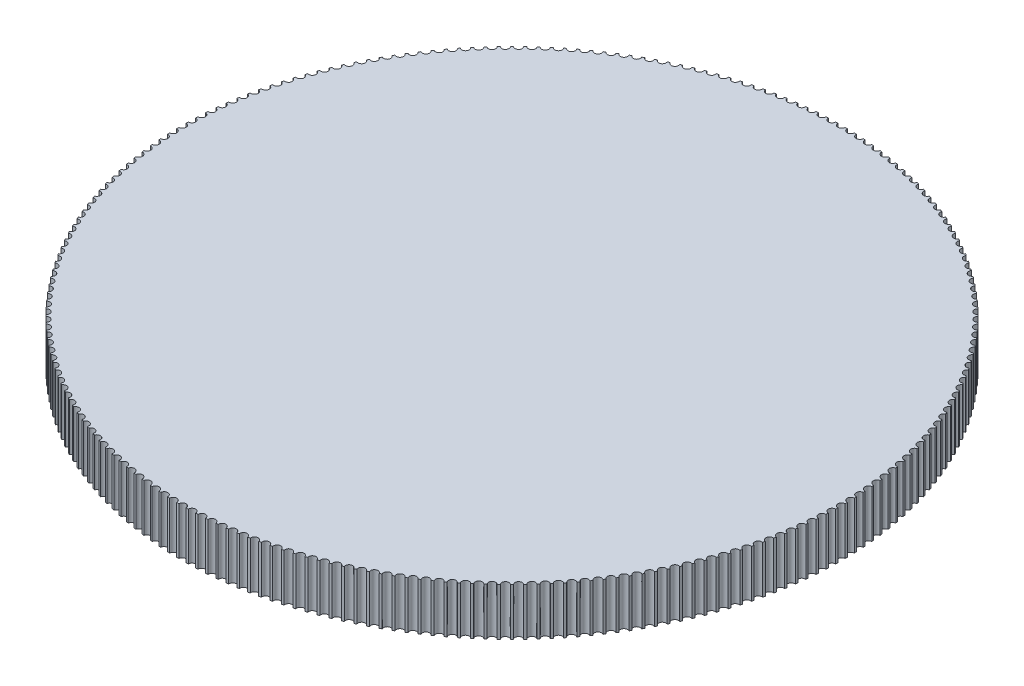
from build123d import *

# Parameters (mm, degrees)
SKETCH1_R           = 69.255
BOSS_EXTRUDE1_DEPTH = 10
SKETCH2_R           = 0.755
CUT_EXTRUDE2_DEPTH  = 10


with BuildPart() as part:
    # Sketch1 → Boss-Extrude1 (new body)
    with BuildSketch(Plane(origin=(0, 0, 0), x_dir=(1, 0, 0), z_dir=(0, 1, 0))):
        with Locations(Location((0, 0, 0), (0, 0, 270))):
            Circle(SKETCH1_R)
    extrude(amount=BOSS_EXTRUDE1_DEPTH)

    # Sketch2 → Cut-Extrude2 (cut)
    with BuildSketch(Plane(origin=(0, 10, 0), x_dir=(1, 0, 0), z_dir=(0, 1, 0))):
        with Locations((69.255, 0)):
            Circle(SKETCH2_R)
        with Locations((69.226757314, -1.977649298)):
            Circle(SKETCH2_R)
        with Locations((69.142052292, -3.953685596)):
            Circle(SKETCH2_R)
        with Locations((69.000954021, -5.926497212)):
            Circle(SKETCH2_R)
        with Locations((68.803577582, -7.894475092)):
            Circle(SKETCH2_R)
        with Locations((68.550083957, -9.856014125)):
            Circle(SKETCH2_R)
        with Locations((68.240679902, -11.809514451)):
            Circle(SKETCH2_R)
        with Locations((67.875617768, -13.753382768)):
            Circle(SKETCH2_R)
        with Locations((67.455195308, -15.686033628)):
            Circle(SKETCH2_R)
        with Locations((66.979755422, -17.605890735)):
            Circle(SKETCH2_R)
        with Locations((66.449685888, -19.511388224)):
            Circle(SKETCH2_R)
        with Locations((65.865419036, -21.400971945)):
            Circle(SKETCH2_R)
        with Locations((65.227431404, -23.273100727)):
            Circle(SKETCH2_R)
        with Locations((64.536243343, -25.126247634)):
            Circle(SKETCH2_R)
        with Locations((63.792418596, -26.958901213)):
            Circle(SKETCH2_R)
        with Locations((62.996563838, -28.769566725)):
            Circle(SKETCH2_R)
        with Locations((62.149328179, -30.556767367)):
            Circle(SKETCH2_R)
        with Locations((61.251402636, -32.31904547)):
            Circle(SKETCH2_R)
        with Locations((60.303519571, -34.054963696)):
            Circle(SKETCH2_R)
        with Locations((59.30645209, -35.763106206)):
            Circle(SKETCH2_R)
        with Locations((58.261013416, -37.442079813)):
            Circle(SKETCH2_R)
        with Locations((57.168056224, -39.090515123)):
            Circle(SKETCH2_R)
        with Locations((56.028471945, -40.707067648)):
            Circle(SKETCH2_R)
        with Locations((54.843190041, -42.290418904)):
            Circle(SKETCH2_R)
        with Locations((53.613177245, -43.839277489)):
            Circle(SKETCH2_R)
        with Locations((52.339436772, -45.352380129)):
            Circle(SKETCH2_R)
        with Locations((51.023007504, -46.828492718)):
            Circle(SKETCH2_R)
        with Locations((49.664963139, -48.266411317)):
            Circle(SKETCH2_R)
        with Locations((48.266411317, -49.664963139)):
            Circle(SKETCH2_R)
        with Locations((46.828492718, -51.023007504)):
            Circle(SKETCH2_R)
        with Locations((45.352380129, -52.339436772)):
            Circle(SKETCH2_R)
        with Locations((43.839277489, -53.613177245)):
            Circle(SKETCH2_R)
        with Locations((42.290418904, -54.843190041)):
            Circle(SKETCH2_R)
        with Locations((40.707067648, -56.028471945)):
            Circle(SKETCH2_R)
        with Locations((39.090515123, -57.168056224)):
            Circle(SKETCH2_R)
        with Locations((37.442079813, -58.261013416)):
            Circle(SKETCH2_R)
        with Locations((35.763106206, -59.30645209)):
            Circle(SKETCH2_R)
        with Locations((34.054963696, -60.303519571)):
            Circle(SKETCH2_R)
        with Locations((32.31904547, -61.251402636)):
            Circle(SKETCH2_R)
        with Locations((30.556767367, -62.149328179)):
            Circle(SKETCH2_R)
        with Locations((28.769566725, -62.996563838)):
            Circle(SKETCH2_R)
        with Locations((26.958901213, -63.792418596)):
            Circle(SKETCH2_R)
        with Locations((25.126247634, -64.536243343)):
            Circle(SKETCH2_R)
        with Locations((23.273100727, -65.227431404)):
            Circle(SKETCH2_R)
        with Locations((21.400971945, -65.865419036)):
            Circle(SKETCH2_R)
        with Locations((19.511388224, -66.449685888)):
            Circle(SKETCH2_R)
        with Locations((17.605890735, -66.979755422)):
            Circle(SKETCH2_R)
        with Locations((15.686033628, -67.455195308)):
            Circle(SKETCH2_R)
        with Locations((13.753382768, -67.875617768)):
            Circle(SKETCH2_R)
        with Locations((11.809514451, -68.240679902)):
            Circle(SKETCH2_R)
        with Locations((9.856014125, -68.550083957)):
            Circle(SKETCH2_R)
        with Locations((7.894475092, -68.803577582)):
            Circle(SKETCH2_R)
        with Locations((5.926497212, -69.000954021)):
            Circle(SKETCH2_R)
        with Locations((3.953685596, -69.142052292)):
            Circle(SKETCH2_R)
        with Locations((1.977649298, -69.226757314)):
            Circle(SKETCH2_R)
        with Locations((0, -69.255)):
            Circle(SKETCH2_R)
        with Locations((-1.977649298, -69.226757314)):
            Circle(SKETCH2_R)
        with Locations((-3.953685596, -69.142052292)):
            Circle(SKETCH2_R)
        with Locations((-5.926497212, -69.000954021)):
            Circle(SKETCH2_R)
        with Locations((-7.894475092, -68.803577582)):
            Circle(SKETCH2_R)
        with Locations((-9.856014125, -68.550083957)):
            Circle(SKETCH2_R)
        with Locations((-11.809514451, -68.240679902)):
            Circle(SKETCH2_R)
        with Locations((-13.753382768, -67.875617768)):
            Circle(SKETCH2_R)
        with Locations((-15.686033628, -67.455195308)):
            Circle(SKETCH2_R)
        with Locations((-17.605890735, -66.979755422)):
            Circle(SKETCH2_R)
        with Locations((-19.511388224, -66.449685888)):
            Circle(SKETCH2_R)
        with Locations((-21.400971945, -65.865419036)):
            Circle(SKETCH2_R)
        with Locations((-23.273100727, -65.227431404)):
            Circle(SKETCH2_R)
        with Locations((-25.126247634, -64.536243343)):
            Circle(SKETCH2_R)
        with Locations((-26.958901213, -63.792418596)):
            Circle(SKETCH2_R)
        with Locations((-28.769566725, -62.996563838)):
            Circle(SKETCH2_R)
        with Locations((-30.556767367, -62.149328179)):
            Circle(SKETCH2_R)
        with Locations((-32.31904547, -61.251402636)):
            Circle(SKETCH2_R)
        with Locations((-34.054963696, -60.303519571)):
            Circle(SKETCH2_R)
        with Locations((-35.763106206, -59.30645209)):
            Circle(SKETCH2_R)
        with Locations((-37.442079813, -58.261013416)):
            Circle(SKETCH2_R)
        with Locations((-39.090515123, -57.168056224)):
            Circle(SKETCH2_R)
        with Locations((-40.707067648, -56.028471945)):
            Circle(SKETCH2_R)
        with Locations((-42.290418904, -54.843190041)):
            Circle(SKETCH2_R)
        with Locations((-43.839277489, -53.613177245)):
            Circle(SKETCH2_R)
        with Locations((-45.352380129, -52.339436772)):
            Circle(SKETCH2_R)
        with Locations((-46.828492718, -51.023007504)):
            Circle(SKETCH2_R)
        with Locations((-48.266411317, -49.664963139)):
            Circle(SKETCH2_R)
        with Locations((-49.664963139, -48.266411317)):
            Circle(SKETCH2_R)
        with Locations((-51.023007504, -46.828492718)):
            Circle(SKETCH2_R)
        with Locations((-52.339436772, -45.352380129)):
            Circle(SKETCH2_R)
        with Locations((-53.613177245, -43.839277489)):
            Circle(SKETCH2_R)
        with Locations((-54.843190041, -42.290418904)):
            Circle(SKETCH2_R)
        with Locations((-56.028471945, -40.707067648)):
            Circle(SKETCH2_R)
        with Locations((-57.168056224, -39.090515123)):
            Circle(SKETCH2_R)
        with Locations((-58.261013416, -37.442079813)):
            Circle(SKETCH2_R)
        with Locations((-59.30645209, -35.763106206)):
            Circle(SKETCH2_R)
        with Locations((-60.303519571, -34.054963696)):
            Circle(SKETCH2_R)
        with Locations((-61.251402636, -32.31904547)):
            Circle(SKETCH2_R)
        with Locations((-62.149328179, -30.556767367)):
            Circle(SKETCH2_R)
        with Locations((-62.996563838, -28.769566725)):
            Circle(SKETCH2_R)
        with Locations((-63.792418596, -26.958901213)):
            Circle(SKETCH2_R)
        with Locations((-64.536243343, -25.126247634)):
            Circle(SKETCH2_R)
        with Locations((-65.227431404, -23.273100727)):
            Circle(SKETCH2_R)
        with Locations((-65.865419036, -21.400971945)):
            Circle(SKETCH2_R)
        with Locations((-66.449685888, -19.511388224)):
            Circle(SKETCH2_R)
        with Locations((-66.979755422, -17.605890735)):
            Circle(SKETCH2_R)
        with Locations((-67.455195308, -15.686033628)):
            Circle(SKETCH2_R)
        with Locations((-67.875617768, -13.753382768)):
            Circle(SKETCH2_R)
        with Locations((-68.240679902, -11.809514451)):
            Circle(SKETCH2_R)
        with Locations((-68.550083957, -9.856014125)):
            Circle(SKETCH2_R)
        with Locations((-68.803577582, -7.894475092)):
            Circle(SKETCH2_R)
        with Locations((-69.000954021, -5.926497212)):
            Circle(SKETCH2_R)
        with Locations((-69.142052292, -3.953685596)):
            Circle(SKETCH2_R)
        with Locations((-69.226757314, -1.977649298)):
            Circle(SKETCH2_R)
        with Locations((-69.255, 0)):
            Circle(SKETCH2_R)
        with Locations((-69.226757314, 1.977649298)):
            Circle(SKETCH2_R)
        with Locations((-69.142052292, 3.953685596)):
            Circle(SKETCH2_R)
        with Locations((-69.000954021, 5.926497212)):
            Circle(SKETCH2_R)
        with Locations((-68.803577582, 7.894475092)):
            Circle(SKETCH2_R)
        with Locations((-68.550083957, 9.856014125)):
            Circle(SKETCH2_R)
        with Locations((-68.240679902, 11.809514451)):
            Circle(SKETCH2_R)
        with Locations((-67.875617768, 13.753382768)):
            Circle(SKETCH2_R)
        with Locations((-67.455195308, 15.686033628)):
            Circle(SKETCH2_R)
        with Locations((-66.979755422, 17.605890735)):
            Circle(SKETCH2_R)
        with Locations((-66.449685888, 19.511388224)):
            Circle(SKETCH2_R)
        with Locations((-65.865419036, 21.400971945)):
            Circle(SKETCH2_R)
        with Locations((-65.227431404, 23.273100727)):
            Circle(SKETCH2_R)
        with Locations((-64.536243343, 25.126247634)):
            Circle(SKETCH2_R)
        with Locations((-63.792418596, 26.958901213)):
            Circle(SKETCH2_R)
        with Locations((-62.996563838, 28.769566725)):
            Circle(SKETCH2_R)
        with Locations((-62.149328179, 30.556767367)):
            Circle(SKETCH2_R)
        with Locations((-61.251402636, 32.31904547)):
            Circle(SKETCH2_R)
        with Locations((-60.303519571, 34.054963696)):
            Circle(SKETCH2_R)
        with Locations((-59.30645209, 35.763106206)):
            Circle(SKETCH2_R)
        with Locations((-58.261013416, 37.442079813)):
            Circle(SKETCH2_R)
        with Locations((-57.168056224, 39.090515123)):
            Circle(SKETCH2_R)
        with Locations((-56.028471945, 40.707067648)):
            Circle(SKETCH2_R)
        with Locations((-54.843190041, 42.290418904)):
            Circle(SKETCH2_R)
        with Locations((-53.613177245, 43.839277489)):
            Circle(SKETCH2_R)
        with Locations((-52.339436772, 45.352380129)):
            Circle(SKETCH2_R)
        with Locations((-51.023007504, 46.828492718)):
            Circle(SKETCH2_R)
        with Locations((-49.664963139, 48.266411317)):
            Circle(SKETCH2_R)
        with Locations((-48.266411317, 49.664963139)):
            Circle(SKETCH2_R)
        with Locations((-46.828492718, 51.023007504)):
            Circle(SKETCH2_R)
        with Locations((-45.352380129, 52.339436772)):
            Circle(SKETCH2_R)
        with Locations((-43.839277489, 53.613177245)):
            Circle(SKETCH2_R)
        with Locations((-42.290418904, 54.843190041)):
            Circle(SKETCH2_R)
        with Locations((-40.707067648, 56.028471945)):
            Circle(SKETCH2_R)
        with Locations((-39.090515123, 57.168056224)):
            Circle(SKETCH2_R)
        with Locations((-37.442079813, 58.261013416)):
            Circle(SKETCH2_R)
        with Locations((-35.763106206, 59.30645209)):
            Circle(SKETCH2_R)
        with Locations((-34.054963696, 60.303519571)):
            Circle(SKETCH2_R)
        with Locations((-32.31904547, 61.251402636)):
            Circle(SKETCH2_R)
        with Locations((-30.556767367, 62.149328179)):
            Circle(SKETCH2_R)
        with Locations((-28.769566725, 62.996563838)):
            Circle(SKETCH2_R)
        with Locations((-26.958901213, 63.792418596)):
            Circle(SKETCH2_R)
        with Locations((-25.126247634, 64.536243343)):
            Circle(SKETCH2_R)
        with Locations((-23.273100727, 65.227431404)):
            Circle(SKETCH2_R)
        with Locations((-21.400971945, 65.865419036)):
            Circle(SKETCH2_R)
        with Locations((-19.511388224, 66.449685888)):
            Circle(SKETCH2_R)
        with Locations((-17.605890735, 66.979755422)):
            Circle(SKETCH2_R)
        with Locations((-15.686033628, 67.455195308)):
            Circle(SKETCH2_R)
        with Locations((-13.753382768, 67.875617768)):
            Circle(SKETCH2_R)
        with Locations((-11.809514451, 68.240679902)):
            Circle(SKETCH2_R)
        with Locations((-9.856014125, 68.550083957)):
            Circle(SKETCH2_R)
        with Locations((-7.894475092, 68.803577582)):
            Circle(SKETCH2_R)
        with Locations((-5.926497212, 69.000954021)):
            Circle(SKETCH2_R)
        with Locations((-3.953685596, 69.142052292)):
            Circle(SKETCH2_R)
        with Locations((-1.977649298, 69.226757314)):
            Circle(SKETCH2_R)
        with Locations((0, 69.255)):
            Circle(SKETCH2_R)
        with Locations((1.977649298, 69.226757314)):
            Circle(SKETCH2_R)
        with Locations((3.953685596, 69.142052292)):
            Circle(SKETCH2_R)
        with Locations((5.926497212, 69.000954021)):
            Circle(SKETCH2_R)
        with Locations((7.894475092, 68.803577582)):
            Circle(SKETCH2_R)
        with Locations((9.856014125, 68.550083957)):
            Circle(SKETCH2_R)
        with Locations((11.809514451, 68.240679902)):
            Circle(SKETCH2_R)
        with Locations((13.753382768, 67.875617768)):
            Circle(SKETCH2_R)
        with Locations((15.686033628, 67.455195308)):
            Circle(SKETCH2_R)
        with Locations((17.605890735, 66.979755422)):
            Circle(SKETCH2_R)
        with Locations((19.511388224, 66.449685888)):
            Circle(SKETCH2_R)
        with Locations((21.400971945, 65.865419036)):
            Circle(SKETCH2_R)
        with Locations((23.273100727, 65.227431404)):
            Circle(SKETCH2_R)
        with Locations((25.126247634, 64.536243343)):
            Circle(SKETCH2_R)
        with Locations((26.958901213, 63.792418596)):
            Circle(SKETCH2_R)
        with Locations((28.769566725, 62.996563838)):
            Circle(SKETCH2_R)
        with Locations((30.556767367, 62.149328179)):
            Circle(SKETCH2_R)
        with Locations((32.31904547, 61.251402636)):
            Circle(SKETCH2_R)
        with Locations((34.054963696, 60.303519571)):
            Circle(SKETCH2_R)
        with Locations((35.763106206, 59.30645209)):
            Circle(SKETCH2_R)
        with Locations((37.442079813, 58.261013416)):
            Circle(SKETCH2_R)
        with Locations((39.090515123, 57.168056224)):
            Circle(SKETCH2_R)
        with Locations((40.707067648, 56.028471945)):
            Circle(SKETCH2_R)
        with Locations((42.290418904, 54.843190041)):
            Circle(SKETCH2_R)
        with Locations((43.839277489, 53.613177245)):
            Circle(SKETCH2_R)
        with Locations((45.352380129, 52.339436772)):
            Circle(SKETCH2_R)
        with Locations((46.828492718, 51.023007504)):
            Circle(SKETCH2_R)
        with Locations((48.266411317, 49.664963139)):
            Circle(SKETCH2_R)
        with Locations((49.664963139, 48.266411317)):
            Circle(SKETCH2_R)
        with Locations((51.023007504, 46.828492718)):
            Circle(SKETCH2_R)
        with Locations((52.339436772, 45.352380129)):
            Circle(SKETCH2_R)
        with Locations((53.613177245, 43.839277489)):
            Circle(SKETCH2_R)
        with Locations((54.843190041, 42.290418904)):
            Circle(SKETCH2_R)
        with Locations((56.028471945, 40.707067648)):
            Circle(SKETCH2_R)
        with Locations((57.168056224, 39.090515123)):
            Circle(SKETCH2_R)
        with Locations((58.261013416, 37.442079813)):
            Circle(SKETCH2_R)
        with Locations((59.30645209, 35.763106206)):
            Circle(SKETCH2_R)
        with Locations((60.303519571, 34.054963696)):
            Circle(SKETCH2_R)
        with Locations((61.251402636, 32.31904547)):
            Circle(SKETCH2_R)
        with Locations((62.149328179, 30.556767367)):
            Circle(SKETCH2_R)
        with Locations((62.996563838, 28.769566725)):
            Circle(SKETCH2_R)
        with Locations((63.792418596, 26.958901213)):
            Circle(SKETCH2_R)
        with Locations((64.536243343, 25.126247634)):
            Circle(SKETCH2_R)
        with Locations((65.227431404, 23.273100727)):
            Circle(SKETCH2_R)
        with Locations((65.865419036, 21.400971945)):
            Circle(SKETCH2_R)
        with Locations((66.449685888, 19.511388224)):
            Circle(SKETCH2_R)
        with Locations((66.979755422, 17.605890735)):
            Circle(SKETCH2_R)
        with Locations((67.455195308, 15.686033628)):
            Circle(SKETCH2_R)
        with Locations((67.875617768, 13.753382768)):
            Circle(SKETCH2_R)
        with Locations((68.240679902, 11.809514451)):
            Circle(SKETCH2_R)
        with Locations((68.550083957, 9.856014125)):
            Circle(SKETCH2_R)
        with Locations((68.803577582, 7.894475092)):
            Circle(SKETCH2_R)
        with Locations((69.000954021, 5.926497212)):
            Circle(SKETCH2_R)
        with Locations((69.142052292, 3.953685596)):
            Circle(SKETCH2_R)
        with Locations((69.226757314, 1.977649298)):
            Circle(SKETCH2_R)
    extrude(amount=-CUT_EXTRUDE2_DEPTH, mode=Mode.SUBTRACT)


solid = part.part
